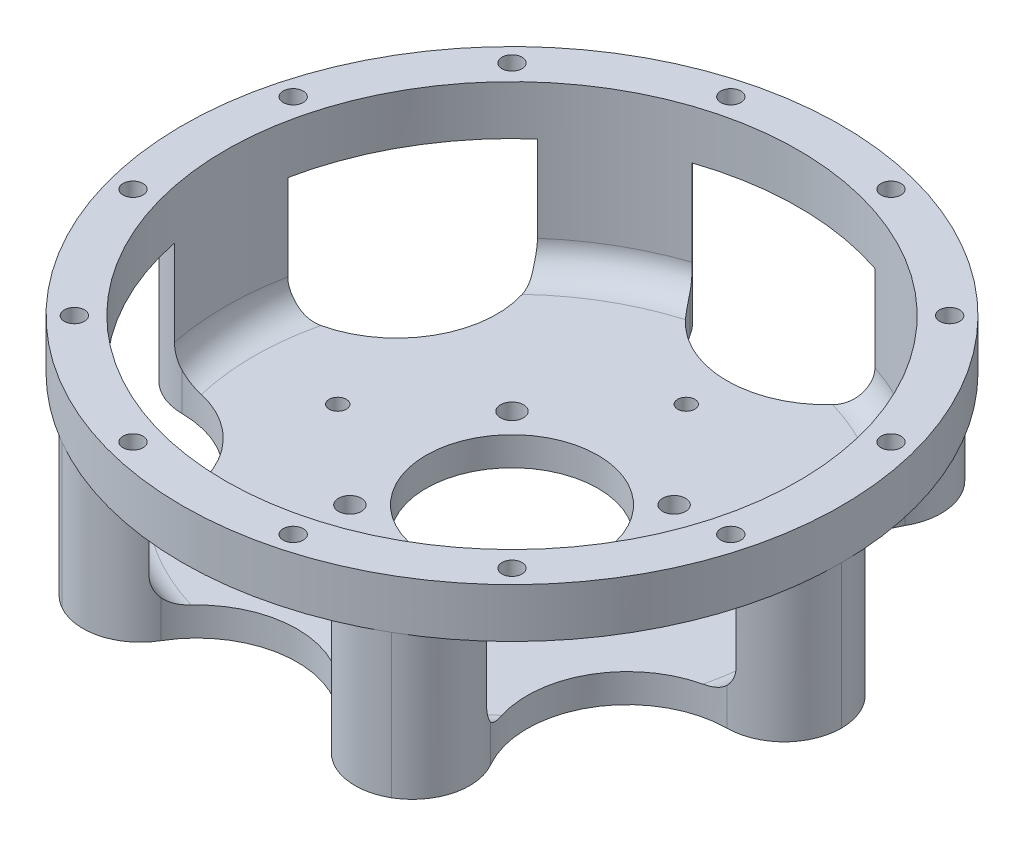
from build123d import *

# Parameters (mm, degrees)
SKETCH1_R           = 57.5
BOSS_EXTRUDE1_DEPTH = 33.6
SKETCH2_R           = 50
CUT_EXTRUDE1_DEPTH  = 28.6
SKETCH7_R           = 1.75
CUT_EXTRUDE4_DEPTH  = 10
FILLET2_R           = 5
SKETCH3_R           = 17.5
CUT_EXTRUDE2_DEPTH  = 25
FILLET1_R           = 10
CIRPATTERN2_DEPTH   = 25
SKETCH5_R           = 1.5
SKETCH5_R_2         = 15
SKETCH5_R_3         = 2
CUT_EXTRUDE3_DEPTH  = 25
CIRPATTERN3_COUNT   = 6


# Read off the part's stored shape, not the designer's step: CirPattern2
with BuildPart() as part:
    # Sketch1 → Boss-Extrude1 (new body)
    with BuildSketch(Plane(origin=(0, 0, 0), x_dir=(1, 0, 0), z_dir=(0, 1, 0))):
        with Locations(Location((0, 0, 0), (0, 0, 270))):
            Circle(SKETCH1_R)
    extrude(amount=BOSS_EXTRUDE1_DEPTH)

    # Sketch2 → Cut-Extrude1 (cut)
    with BuildSketch(Plane(origin=(0, 33.6, 0), x_dir=(1, 0, 0), z_dir=(0, 1, 0))):
        with Locations(Location((0, 0, 0), (0, 0, 270))):
            Circle(SKETCH2_R)
    extrude(amount=-CUT_EXTRUDE1_DEPTH, mode=Mode.SUBTRACT)

    # Sketch7 → Cut-Extrude4 (cut)
    with BuildSketch(Plane(origin=(0, 33.6, 0), x_dir=(1, 0, 0), z_dir=(0, 1, 0))):
        with Locations(Location((-13.976228436, 52.15999462, 0), (0, 0, 270))):
            Circle(SKETCH7_R)
        with Locations(Location((13.976228436, 52.15999462, 0), (0, 0, 270))):
            Circle(SKETCH7_R)
    cut_extrude4 = extrude(amount=-CUT_EXTRUDE4_DEPTH, mode=Mode.SUBTRACT)

    # Fillet2
    fillet2_edges = [part.edges().sort_by_distance(p)[0] for p in [
        (0, 5, -50),
    ]]
    fillet(fillet2_edges, radius=FILLET2_R)

    # Sketch3 → Cut-Extrude2 (cut)
    with BuildSketch(Plane.XZ):
        with Locations((0, 55)):
            Circle(SKETCH3_R)
    extrude(amount=-CUT_EXTRUDE2_DEPTH, mode=Mode.SUBTRACT)

    # Fillet1
    # the kernel refuses this fillet: 10 mm, written as the material it takes off along each edge
    with BuildSketch(Plane(origin=(-17.498524141, 25, 54.772727273), x_dir=(0.2673887878652172, 0, -0.9635887276862313), z_dir=(0, -1, 0))) as fillet1_piece_1:
        with BuildLine():
            CenterArc((11.468344426, -9.669800453), FILLET1_R, 104.764821464, 89.725856468)
            ThreePointArc((1.78646078, -12.172025276), (0.566760136, -6.133927943), (0, 0))
            ThreePointArc((0, 0), (4.459911721, -0.577849208), (8.919823443, 0))
        make_face()
    extrude(amount=55.756060526, mode=Mode.SUBTRACT)
    with BuildSketch(Plane(origin=(17.498524141, 25, 54.772727273), x_dir=(-0.2673887878652174, 0, -0.9635887276862313), z_dir=(0, -1, 0))) as fillet1_piece_2:
        with BuildLine():
            CenterArc((11.468344426, 9.669800453), FILLET1_R, 165.509322068, 89.725856468)
            ThreePointArc((1.78646078, 12.172025276), (0.566760136, 6.133927943), (0, 0))
            ThreePointArc((0, 0), (4.459911721, 0.577849208), (8.919823443, 0))
        make_face()
    extrude(amount=55.756060526, mode=Mode.SUBTRACT)

    # CirPattern2 outline → CirPattern2 (cut)
    with BuildSketch(Plane(origin=(0, 0, 0), x_dir=(1, 0, 0), z_dir=(0, 1, 0))):
        with BuildLine():
            ThreePointArc((-32.43431744, -36.177486186), (-32.475952642, -18.75), (-47.547780802, -10.000199764))
            ThreePointArc((-47.547780802, -10.000199764), (-54.587917435, -7.054491856), (-57.499999999, -0.000380002))
            ThreePointArc((-57.499999999, -0.000380002), (-49.796460718, -28.75), (-28.750329091, -49.796270715))
            ThreePointArc((-28.750329091, -49.796270715), (-33.403327875, -43.747277311), (-32.43431744, -36.177486186))
        make_face()
        with BuildLine():
            ThreePointArc((-32.43431744, 36.177486186), (-33.403327875, 43.747277311), (-28.750329091, 49.796270715))
            ThreePointArc((-28.750329091, 49.796270715), (-49.796460718, 28.75), (-57.499999999, 0.000380002))
            ThreePointArc((-57.499999999, 0.000380002), (-54.587917435, 7.054491856), (-47.547780802, 10.000199764))
            ThreePointArc((-47.547780802, 10.000199764), (-32.475952642, 18.75), (-32.43431744, 36.177486186))
        make_face()
        with BuildLine():
            ThreePointArc((57.499999999, -0.000380002), (54.587917435, -7.054491856), (47.547780802, -10.000199764))
            ThreePointArc((47.547780802, -10.000199764), (32.475952642, -18.75), (32.43431744, -36.177486186))
            ThreePointArc((32.43431744, -36.177486186), (33.403327875, -43.747277311), (28.750329091, -49.796270715))
            ThreePointArc((28.750329091, -49.796270715), (49.796460718, -28.75), (57.499999999, -0.000380002))
        make_face()
        with BuildLine():
            ThreePointArc((15.113463363, 46.17768595), (21.18458956, 50.801769166), (28.749670908, 49.796650718))
            ThreePointArc((28.749670908, 49.796650718), (0, 57.5), (-28.749670908, 49.796650718))
            ThreePointArc((-28.749670908, 49.796650718), (-21.18458956, 50.801769166), (-15.113463363, 46.17768595))
            ThreePointArc((-15.113463363, 46.17768595), (0, 37.5), (15.113463363, 46.17768595))
        make_face()
        with BuildLine():
            ThreePointArc((28.750329091, 49.796270715), (33.403327875, 43.747277311), (32.43431744, 36.177486186))
            ThreePointArc((32.43431744, 36.177486186), (32.475952642, 18.75), (47.547780802, 10.000199764))
            ThreePointArc((47.547780802, 10.000199764), (54.587917435, 7.054491856), (57.499999999, 0.000380002))
            ThreePointArc((57.499999999, 0.000380002), (49.796460718, 28.75), (28.750329091, 49.796270715))
        make_face()
    extrude(amount=CIRPATTERN2_DEPTH, mode=Mode.SUBTRACT)

    # Sketch5 → Cut-Extrude3 (cut)
    with BuildSketch(Plane.XZ):
        with Locations(Location((0, 30.405591591, 0), (0, 0, 270))):
            Circle(SKETCH5_R)
        with Locations(Location((30.405591591, 0, 0), (0, 0, 270))):
            Circle(SKETCH5_R)
        with Locations(Location((0, -30.405591591, 0), (0, 0, 270))):
            Circle(SKETCH5_R)
        with Locations(Location((-30.405591591, 0, 0), (0, 0, 270))):
            Circle(SKETCH5_R)
        with Locations(Location((0, 0, 0), (0, 0, 270))):
            Circle(SKETCH5_R_2)
        with Locations(Location((-14.142135624, -14.142135624, 0), (0, 0, 270))):
            Circle(SKETCH5_R_3)
        with Locations(Location((-14.142135624, 14.142135624, 0), (0, 0, 270))):
            Circle(SKETCH5_R_3)
        with Locations(Location((14.142135624, 14.142135624, 0), (0, 0, 270))):
            Circle(SKETCH5_R_3)
        with Locations(Location((14.142135624, -14.142135624, 0), (0, 0, 270))):
            Circle(SKETCH5_R_3)
    extrude(amount=-CUT_EXTRUDE3_DEPTH, mode=Mode.SUBTRACT)

    # CirPattern3: Cut-Extrude4 ×6 about axis
    cirpattern3_axis = Axis((0, 0, 0), (0, 1, 0))
    for i in range(1, CIRPATTERN3_COUNT):
        add(cut_extrude4.rotate(cirpattern3_axis, i * 360 / CIRPATTERN3_COUNT), mode=Mode.SUBTRACT)


solid = part.part
